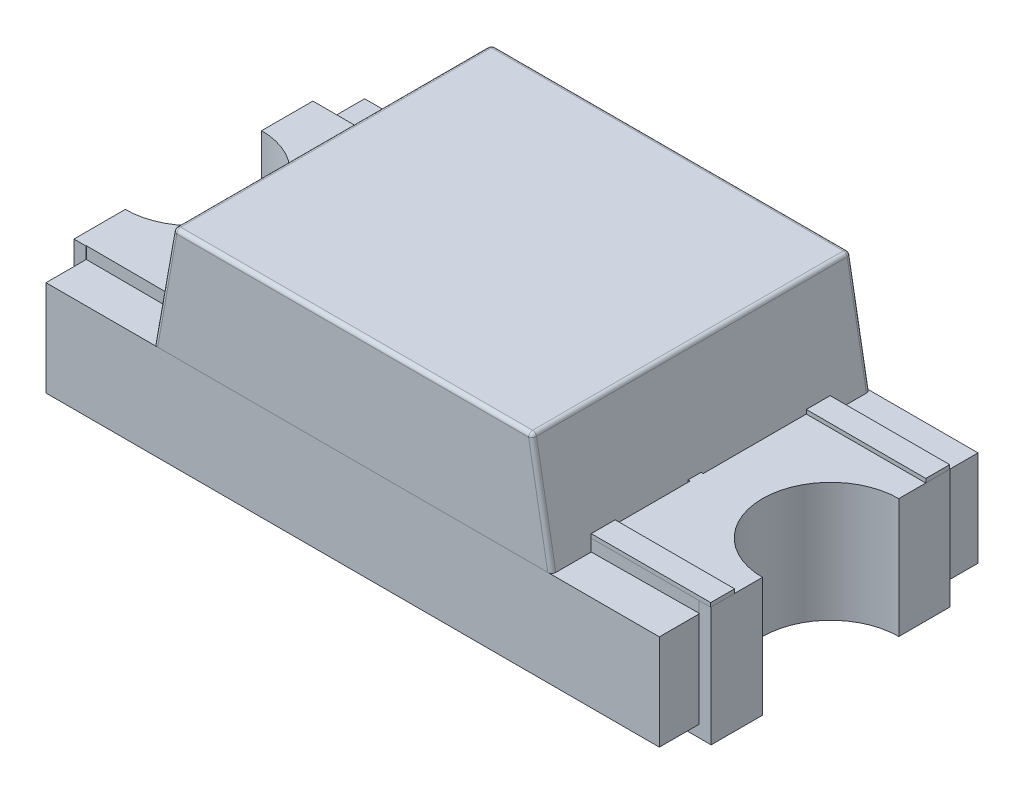
from build123d import *

# Parameters (mm, degrees)
EXTRUDE_1_DEPTH   = 0.03
EXTRUDE_1_2_DEPTH = 0.03
EXTRUDE_2_DEPTH   = 0.27
EXTRUDE_3_DEPTH   = 0.24
EXTRUDE_4_DEPTH   = 0.03
EXTRUDE_4_2_DEPTH = 0.03
SKETCH_9_R        = 0.04
EXTRUDE_5_DEPTH   = 0.03
FILLET_1_R        = 0.04
FILLET_2_R        = 0.01
SKETCH_18_W       = 0.3
SKETCH_18_H       = 0.06
EXTRUDE_8_DEPTH   = 0.01
EXTRUDE_8_2_DEPTH = 0.01


with BuildPart() as part:
    # Эскиз1 → Бобышка-Вытянуть1 (new body)
    with BuildSketch(Plane(origin=(0, 0, 0), x_dir=(1, 0, 0), z_dir=(0, 1, 0))):
        with BuildLine():
            Line((-0.8, 0.3), (-0.8, 0.171196845))
            ThreePointArc((-0.8, 0.171196845), (-0.628803155, 0), (-0.8, -0.171196845))
            Line((-0.8, -0.171196845), (-0.8, -0.3))
            Line((-0.8, -0.3), (-0.5, -0.3))
            Line((-0.5, -0.3), (-0.5, 0.3))
            Line((-0.5, 0.3), (-0.8, 0.3))
        make_face()
    extrude(amount=EXTRUDE_1_DEPTH)



with BuildPart() as body_2:
    # Эскиз1 → Extrude 1 2 (new body)
    with BuildSketch(Plane(origin=(0, 0, 0), x_dir=(1, 0, 0), z_dir=(0, 1, 0))):
        with BuildLine():
            Line((0.8, 0.3), (0.5, 0.3))
            Line((0.5, 0.3), (0.5, -0.3))
            Line((0.5, -0.3), (0.8, -0.3))
            Line((0.8, -0.3), (0.8, -0.171196845))
            ThreePointArc((0.8, -0.171196845), (0.628803155, 0), (0.8, 0.171196845))
            Line((0.8, 0.171196845), (0.8, 0.3))
        make_face()
    extrude(amount=EXTRUDE_1_2_DEPTH)


with BuildPart() as part_1:
    add(part.part)

    add(body_2.part)  # Бобышка-Вытянуть2 merges body 2
    # Эскиз2 → Бобышка-Вытянуть2 (add)
    with BuildSketch(Plane(origin=(0, 0.03, 0), x_dir=(1, 0, 0), z_dir=(0, 1, 0))):
        with BuildLine():
            Line((-0.8, 0.171196845), (-0.8, 0.3))
            Line((-0.8, 0.3), (-0.770127922, 0.3))
            Line((-0.770127922, 0.3), (-0.770127922, 0.197756565))
            ThreePointArc((-0.770127922, 0.197756565), (-0.6, 0), (-0.770127922, -0.197756565))
            Line((-0.770127922, -0.197756565), (-0.770127922, -0.3))
            Line((-0.770127922, -0.3), (-0.8, -0.3))
            Line((-0.8, -0.3), (-0.8, -0.171196845))
            ThreePointArc((-0.8, -0.171196845), (-0.628803155, 0), (-0.8, 0.171196845))
        make_face()
        with BuildLine():
            Line((0.8, 0.171196845), (0.8, 0.3))
            Line((0.8, 0.3), (0.770002872, 0.3))
            Line((0.770002872, 0.3), (0.770002872, 0.197737635))
            ThreePointArc((0.770002872, 0.197737635), (0.6, 0), (0.770002872, -0.197737635))
            Line((0.770002872, -0.197737635), (0.770002872, -0.3))
            Line((0.770002872, -0.3), (0.8, -0.3))
            Line((0.8, -0.3), (0.8, -0.171196845))
            ThreePointArc((0.8, -0.171196845), (0.628803155, 0), (0.8, 0.171196845))
        make_face()
    extrude(amount=EXTRUDE_2_DEPTH)


with BuildPart() as body_2_2:
    # Эскиз3 → Бобышка-Вытянуть3 (new body)
    with BuildSketch(Plane(origin=(0, 0.03, 0), x_dir=(1, 0, 0), z_dir=(0, 1, 0))):
        with BuildLine():
            Line((-0.770127922, 0.197756565), (-0.770127922, 0.4))
            Line((-0.770127922, 0.4), (0.770002872, 0.4))
            Line((0.770002872, 0.4), (0.770002872, 0.197737635))
            ThreePointArc((0.770002872, 0.197737635), (0.6, 0), (0.770002872, -0.197737635))
            Line((0.770002872, -0.197737635), (0.770002872, -0.4))
            Line((0.770002872, -0.4), (-0.770127922, -0.4))
            Line((-0.770127922, -0.4), (-0.770127922, -0.197756565))
            ThreePointArc((-0.770127922, -0.197756565), (-0.6, 0), (-0.770127922, 0.197756565))
        make_face()
    extrude(amount=EXTRUDE_3_DEPTH)


with BuildPart() as body_3:
    # Эскиз4 → Бобышка-Вытянуть4 (new body)
    with BuildSketch(Plane(origin=(0, 0.27, 0), x_dir=(1, 0, 0), z_dir=(0, 1, 0))):
        with BuildLine():
            Line((-0.770127922, 0.197756565), (-0.770127922, 0.3))
            Line((-0.770127922, 0.3), (-0.500127922, 0.3))
            Line((-0.500127922, 0.3), (-0.500127922, 0.25))
            Line((-0.500127922, 0.25), (-0.378083422, 0.25))
            Line((-0.378083422, 0.25), (-0.378083422, -0.133218672))
            Line((-0.378083422, -0.133218672), (-0.333899038, -0.133218672))
            Line((-0.333899038, -0.133218672), (-0.333899038, -0.25))
            Line((-0.333899038, -0.25), (-0.413899038, -0.25))
            Line((-0.413899038, -0.25), (-0.413899038, 0.21))
            Line((-0.413899038, 0.21), (-0.500127922, 0.21))
            Line((-0.500127922, 0.21), (-0.500127922, -0.3))
            Line((-0.500127922, -0.3), (-0.770127922, -0.298878282))
            Line((-0.770127922, -0.298878282), (-0.770127922, -0.197756565))
            ThreePointArc((-0.770127922, -0.197756565), (-0.6, 0), (-0.770127922, 0.197756565))
        make_face()
    extrude(amount=EXTRUDE_4_DEPTH)


with BuildPart() as body_4:
    # Эскиз4 → Extrude 4 2 (new body)
    with BuildSketch(Plane(origin=(0, 0.27, 0), x_dir=(1, 0, 0), z_dir=(0, 1, 0))):
        with BuildLine():
            Line((0.770002872, 0.197737635), (0.770002872, 0.298868817))
            Line((0.770002872, 0.298868817), (0.500002872, 0.298868817))
            Line((0.500002872, 0.298868817), (0.500002872, -0.02))
            Line((0.500002872, -0.02), (0.43, -0.02))
            Line((0.43, -0.02), (0.43, 0.25))
            Line((0.43, 0.25), (0.34, 0.25))
            Line((0.34, 0.25), (0.34, -0.052883428))
            Line((0.34, -0.052883428), (0.31, -0.052883428))
            Line((0.31, -0.052883428), (0.31, 0.25))
            Line((0.31, 0.25), (-0.25, 0.25))
            Line((-0.25, 0.25), (-0.25, -0.25))
            Line((-0.25, -0.25), (0.25, -0.25))
            Line((0.25, -0.25), (0.25, 0.22))
            Line((0.25, 0.22), (0.28, 0.22))
            Line((0.28, 0.22), (0.28, -0.08))
            Line((0.28, -0.08), (0.37, -0.08))
            Line((0.37, -0.08), (0.37, 0.22))
            Line((0.37, 0.22), (0.4, 0.22))
            Line((0.4, 0.22), (0.4, -0.052883428))
            Line((0.4, -0.052883428), (0.500002872, -0.052883428))
            Line((0.500002872, -0.052883428), (0.500002872, -0.301131183))
            Line((0.500002872, -0.301131183), (0.770002872, -0.298868817))
            Line((0.770002872, -0.298868817), (0.770002872, -0.197737635))
            ThreePointArc((0.770002872, -0.197737635), (0.6, 0), (0.770002872, 0.197737635))
        make_face()
    extrude(amount=EXTRUDE_4_2_DEPTH)


with BuildPart() as body_5:
    # Эскиз9 → Бобышка-Вытянуть5 (new body)
    with BuildSketch(Plane(origin=(0, 0.3, 0), x_dir=(1, 0, 0), z_dir=(0, 1, 0))):
        with Locations(Location((0, 0, 0), (0, 0, 270))):
            Circle(SKETCH_9_R)
    extrude(amount=EXTRUDE_5_DEPTH)

    # Скругление1
    # the kernel refuses this fillet: 0.04 mm, written as the material it takes off along each edge
    with BuildSketch(Plane(origin=(0, 0.33, 0), x_dir=(0, 0, 1), z_dir=(-1, 0, 0))) as fillet_1_piece_1:
        with BuildLine():
            CenterArc((0.001270167, -0.04), FILLET_1_R, 14.477512185, 75.522487815)
            Line((0.001270167, 0), (0.001270167, 0.0008))
            Line((0.001270167, 0.0008), (0.04, 0.0008))
            Line((0.04, 0.0008), (0.0408, 0))
            ThreePointArc((0.0408, 0), (0.0408, -0.015), (0.040774597, -0.0298))
            Line((0.040774597, -0.0298), (0.04, -0.03))
        make_face()
    revolve(axis=Axis((0, 0.33, 0), (0, 1, 0)), mode=Mode.SUBTRACT)


with BuildPart() as body_6:
    # По траектории1: sweep along a path in Эскиз11
    with BuildLine(Plane(origin=(0, 0, 0), x_dir=(-0.8899466991308816, 0, 0.4560645488371663), z_dir=(-0.4560645488371663, 0, -0.8899466991308816))) as sweep_1_path:
        Line((0.42013644, 0.3), (0.42013644, 0.310688593))
        ThreePointArc((0.42013644, 0.310688593), (0.417454992, 0.317503194), (0.41084868, 0.320663196))
        Line((0.41084868, 0.320663196), (0.01071224, 0.349235088))
        ThreePointArc((0.01071224, 0.349235088), (0.003185398, 0.346579037), (0, 0.339260485))
        Line((0, 0.339260485), (0, 0.33))
    # Эскиз14 → По траектории1 (sweep)
    with BuildSketch(Plane(origin=(0, 0.3, 0), x_dir=(1, 0, 0), z_dir=(0, 1, 0))):
        Polygon((-0.382909417, -0.184990192), (-0.37400995, -0.180429546), (-0.364888659, -0.19822848), (-0.373788126, -0.202789126), align=None)
    sweep(path=sweep_1_path.line)


with BuildPart() as body_7:
    # Эскиз5 → По сечениям1 section 0
    with BuildSketch(Plane(origin=(0, 0.27, 0), x_dir=(1, 0, 0), z_dir=(0, 1, 0))):
        with BuildLine():
            Line((-0.5, -0.4), (0.5, -0.4))
            Line((0.5, -0.4), (0.5, 0.4))
            Line((0.5, 0.4), (-0.5, 0.4))
            Line((-0.5, 0.4), (-0.5, -0.4))
        make_face()
    # Эскиз17 → По сечениям1 section 1
    with BuildSketch(Plane(origin=(0, 0.55, 0), x_dir=(1, 0, 0), z_dir=(0, 1, 0))):
        with BuildLine():
            Line((-0.45, 0.4), (0.45, 0.4))
            Line((0.45, 0.4), (0.45, -0.4))
            Line((0.45, -0.4), (-0.45, -0.4))
            Line((-0.45, -0.4), (-0.45, 0.4))
        make_face()
    loft()

    # Скругление2
    fillet_2_edges = [body_7.edges().sort_by_distance(p)[0] for p in [
        (-0.475, 0.41, -0.4),
        (0.475, 0.41, -0.4),
        (0.475, 0.41, 0.4),
        (-0.475, 0.41, 0.4),
        (-0.45, 0.55, 0),
        (0, 0.55, -0.4),
        (0.45, 0.55, 0),
        (0, 0.55, 0.4),
    ]]
    fillet(fillet_2_edges, radius=FILLET_2_R)


with BuildPart() as body_8:
    # Эскиз18 → Бобышка-Вытянуть8 (new body)
    with BuildSketch(Plane(origin=(0, 0.3, 0), x_dir=(1, 0, 0), z_dir=(0, 1, 0))):
        with Locations((0.650002872, 0.268868817)):
            Rectangle(SKETCH_18_W, SKETCH_18_H)
    extrude(amount=EXTRUDE_8_DEPTH)


with BuildPart() as body_9:
    # Эскиз18 → Extrude 8 2 (new body)
    with BuildSketch(Plane(origin=(0, 0.3, 0), x_dir=(1, 0, 0), z_dir=(0, 1, 0))):
        with Locations((0.650002872, -0.271131183)):
            Rectangle(SKETCH_18_W, SKETCH_18_H)
    extrude(amount=EXTRUDE_8_2_DEPTH)


with BuildPart() as part_2:
    add(part_1.part)

    # Combine 5: union body 4
    add(body_4.part)


with BuildPart() as body_3_1:
    add(body_3.part)

    # Combine 6: union part
    add(part_2.part)


solid = Compound([body_2_2.part, body_5.part, body_6.part, body_7.part, body_8.part, body_9.part, body_3_1.part])
